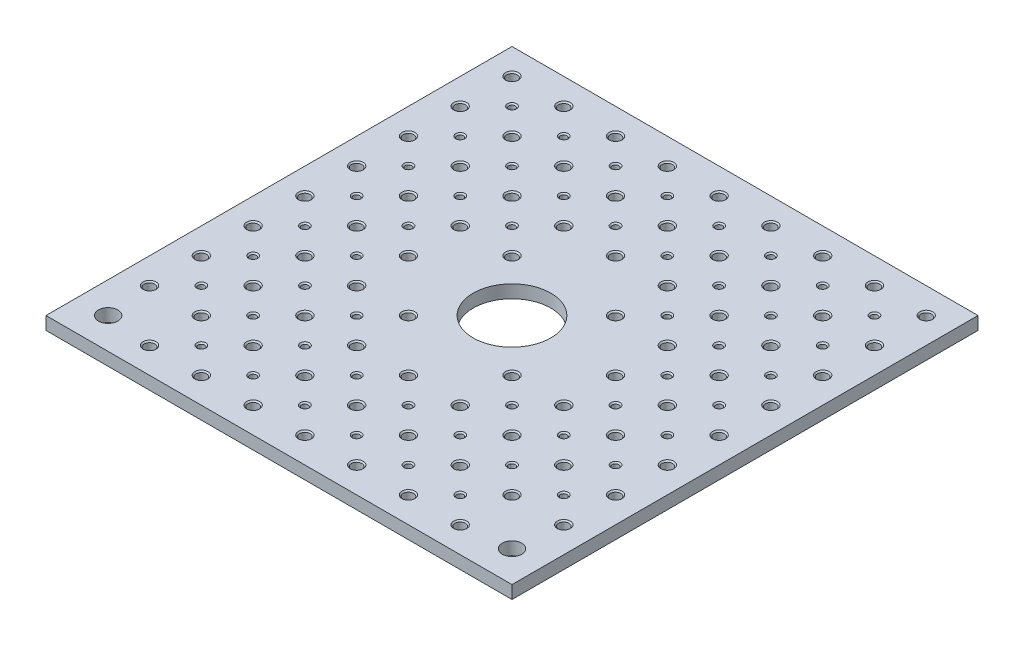
from build123d import *

# Parameters (mm, degrees)
SKETCH1_W                              = 228.6
SKETCH1_H                              = 228.6
BOSS_EXTRUDE1_DEPTH                    = 3.175
SKETCH2_R                              = 19.05
CUT_EXTRUDE1_DEPTH                     = 162.769287876
F_3_8_0_3750_DOWEL_HOLE1_D             = 9.525
TAP_DRILL_FOR_10_HELICOIL3_D           = 5.1054
TAP_DRILL_FOR_10_HELICOIL3_CSINK_D     = 6.3754
TAP_DRILL_FOR_10_HELICOIL3_CSINK_ANGLE = 90
F_1_8_0_1250_DOWEL_HOLE1_D             = 3.175
F_1_8_0_1250_DOWEL_HOLE1_CSINK_D       = 4.445
F_1_8_0_1250_DOWEL_HOLE1_CSINK_ANGLE   = 90
THREAD_HOLE_PATTERN_COUNT              = 9
THREAD_HOLE_PATTERN_PITCH              = 25.4
THREAD_HOLE_PATTERN_COUNT_DIR2         = 9
THREAD_HOLE_PATTERN_PITCH_DIR2         = 25.4
PIN_HOLE_PATTERN_COUNT                 = 8
PIN_HOLE_PATTERN_PITCH                 = 25.4
PIN_HOLE_PATTERN_COUNT_DIR2            = 8
PIN_HOLE_PATTERN_PITCH_DIR2            = 25.4


with BuildPart() as part:
    # Sketch1 → Boss-Extrude1 (new, symmetric)
    with BuildSketch(Plane(origin=(0, 0, 0), x_dir=(1, 0, 0), z_dir=(0, 1, 0))):
        Rectangle(SKETCH1_W, SKETCH1_H)
    extrude(amount=BOSS_EXTRUDE1_DEPTH, both=True)

    # Sketch2 → Cut-Extrude1 (cut, through all)
    with BuildSketch(Plane(origin=(0, 3.175, 0), x_dir=(1, 0, 0), z_dir=(0, 1, 0))):
        Circle(SKETCH2_R)
    extrude(amount=-CUT_EXTRUDE1_DEPTH, mode=Mode.SUBTRACT)

    # 3/8 (0.3750) Dowel Hole1 (through all)
    with Locations(Plane(origin=(0, 3.175, 0), x_dir=(1, 0, 0), z_dir=(0, 1, 0))):
        with Locations((-99.06, -99.06), (99.06, -99.06)):
            Hole(F_3_8_0_3750_DOWEL_HOLE1_D / 2)

    # Tap Drill for #10 Helicoil3 (through all)
    with Locations(Plane(origin=(0, 3.175, 0), x_dir=(1, 0, 0), z_dir=(0, 1, 0))):
        with Locations((-101.6, 101.6)):
            tap_drill_for_10_helicoil3 = CounterSinkHole(TAP_DRILL_FOR_10_HELICOIL3_D / 2, TAP_DRILL_FOR_10_HELICOIL3_CSINK_D / 2, counter_sink_angle=TAP_DRILL_FOR_10_HELICOIL3_CSINK_ANGLE)

    # 1/8 (0.1250) Dowel Hole1 (through all)
    with Locations(Plane(origin=(0, 3.175, 0), x_dir=(1, 0, 0), z_dir=(0, 1, 0))):
        with Locations((-88.9, 88.9), (-101.6, 101.6)):
            f_1_8_0_1250_dowel_hole1 = CounterSinkHole(F_1_8_0_1250_DOWEL_HOLE1_D / 2, F_1_8_0_1250_DOWEL_HOLE1_CSINK_D / 2, counter_sink_angle=F_1_8_0_1250_DOWEL_HOLE1_CSINK_ANGLE)

    # Thread Hole Pattern: Tap Drill for _10 Helicoil3 9 × 9, 7 skipped
    with Locations(*[(i * THREAD_HOLE_PATTERN_PITCH, 0, j * THREAD_HOLE_PATTERN_PITCH_DIR2) for i in range(THREAD_HOLE_PATTERN_COUNT) for j in range(THREAD_HOLE_PATTERN_COUNT_DIR2) if (i, j) not in ((0, 0), (0, 8), (3, 4), (4, 3), (4, 4), (4, 5), (5, 4), (8, 8))]):
        add(tap_drill_for_10_helicoil3, mode=Mode.SUBTRACT)

    # Pin Hole Pattern: 1_8 _0.1250_ Dowel Hole1 8 × 8, 14 skipped
    with Locations(*[(i * PIN_HOLE_PATTERN_PITCH, 0, j * PIN_HOLE_PATTERN_PITCH_DIR2) for i in range(PIN_HOLE_PATTERN_COUNT) for j in range(PIN_HOLE_PATTERN_COUNT_DIR2) if (i, j) not in ((0, 0), (0, 7), (2, 3), (2, 4), (3, 2), (3, 3), (3, 4), (3, 5), (4, 2), (4, 3), (4, 4), (4, 5), (5, 3), (5, 4), (7, 7))]):
        add(f_1_8_0_1250_dowel_hole1, mode=Mode.SUBTRACT)


solid = part.part
